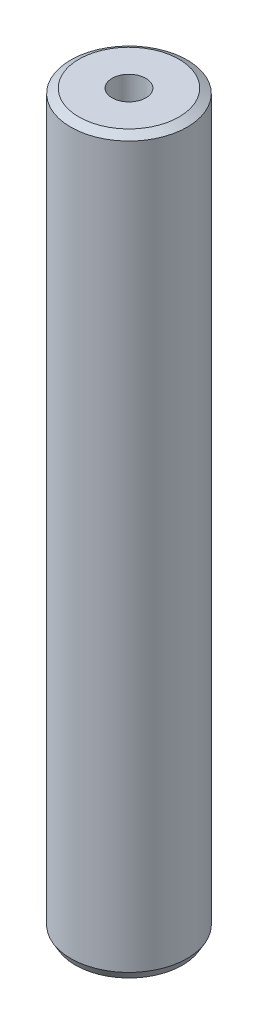
from build123d import *
from OCP.BRepFilletAPI import BRepFilletAPI_MakeChamfer

# Parameters (mm, degrees)
SKETCH1_R           = 35
BOSS_EXTRUDE1_DEPTH = 440.480492631
SKETCH2_R           = 10.175589371
CUT_EXTRUDE1_DEPTH  = 444.2528222
CHAMFER1_SIZE       = 2.837758961
CHAMFER1_SIZE2      = 4.9151427


with BuildPart() as part:
    # Sketch1 → Boss-Extrude1 (new body)
    with BuildSketch(Plane(origin=(0, 0, 0), x_dir=(1, 0, 0), z_dir=(0, 1, 0))):
        Circle(SKETCH1_R)
    extrude(amount=BOSS_EXTRUDE1_DEPTH)

    # Sketch2 → Cut-Extrude1 (cut, through all)
    with BuildSketch(Plane(origin=(0, 0, 0), x_dir=(1, 0, 0), z_dir=(0, 1, 0))):
        Circle(SKETCH2_R)
    extrude(amount=CUT_EXTRUDE1_DEPTH, mode=Mode.SUBTRACT)

    # Chamfer1: one chamfer whose edges measure the first distance from different faces: ONE call of the kernel's chamfer builder (chamfer() names one face for all edges)
    chamfer1_edges_1 = [part.edges().sort_by_distance(p)[0] for p in [
        (-35, 440.480492631, 0),
    ]]
    chamfer1_side_1 = [part.faces().sort_by_distance(p)[0] for p in [
        (-35, 220.240246315, 0),
    ]]
    chamfer1_edges_2 = [part.edges().sort_by_distance(p)[0] for p in [
        (-35, 0, 0),
    ]]
    chamfer1_side_2 = [part.faces().sort_by_distance(p)[0] for p in [
        (-34.010050506, 0, 0),
    ]]
    chamfer1 = BRepFilletAPI_MakeChamfer(part.part.solid().wrapped)
    for e in chamfer1_edges_1:
        chamfer1.Add(CHAMFER1_SIZE, CHAMFER1_SIZE2, e.wrapped, chamfer1_side_1[0].wrapped)  # the first distance lies on this face
    for e in chamfer1_edges_2:
        chamfer1.Add(CHAMFER1_SIZE, CHAMFER1_SIZE2, e.wrapped, chamfer1_side_2[0].wrapped)  # the first distance lies on this face
    add(Compound.cast(chamfer1.Shape()), mode=Mode.REPLACE)


solid = part.part
